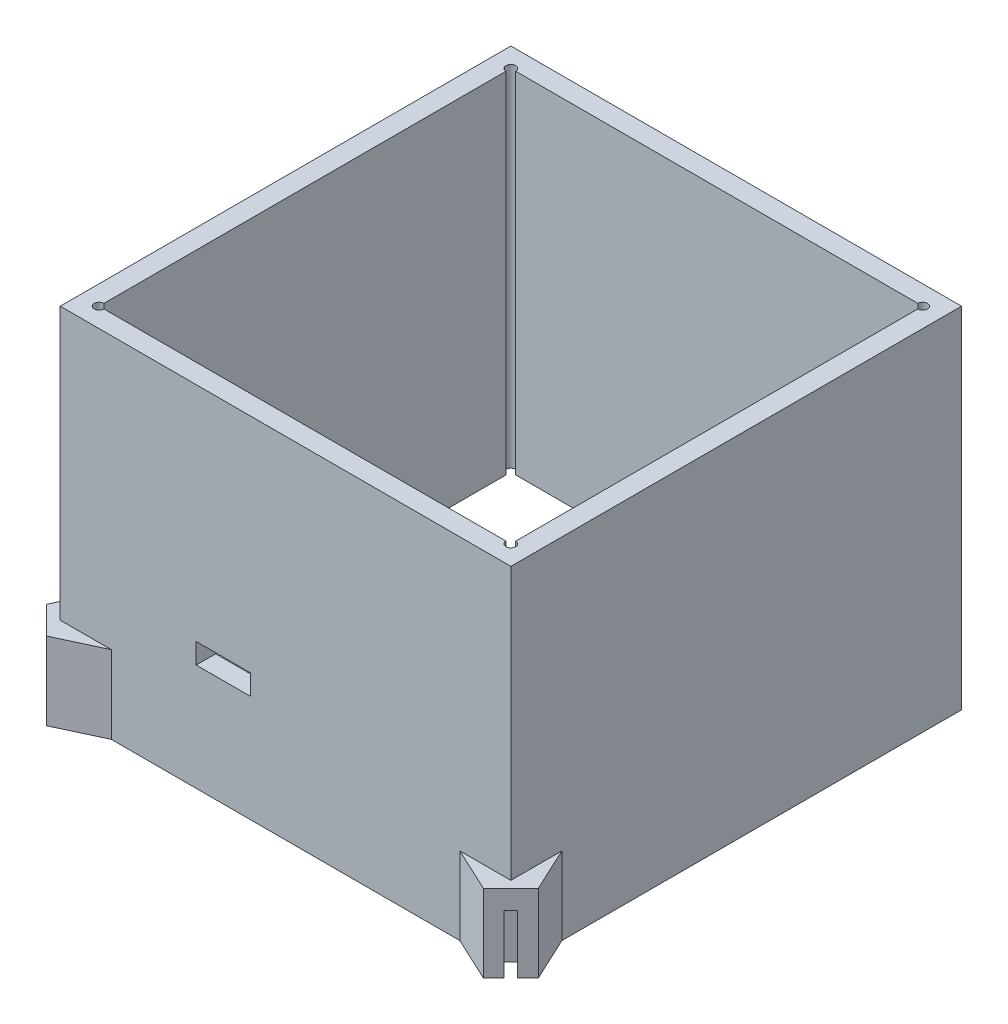
from build123d import *

# Parameters (mm, degrees)
SKETCH2_W           = 232
SKETCH2_H           = 232
SKETCH2_W_2         = 212
SKETCH2_H_2         = 212
BOSS_EXTRUDE1_DEPTH = 180
CUT_EXTRUDE1_REACH  = 317.721
SKETCH3_W           = 28
SKETCH3_H           = 10.5
CUT_EXTRUDE2_REACH  = 317.721
SKETCH4_W           = 28
SKETCH4_H           = 10.5
CUT_EXTRUDE3_REACH  = 245.541
SKETCH5_R           = 2.5
BOSS_EXTRUDE2_DEPTH = 40
BOSS_EXTRUDE3_DEPTH = 40
CUT_EXTRUDE4_DEPTH  = 30


with BuildPart() as part:
    # Sketch2 → Boss-Extrude1 (new body)
    with BuildSketch(Plane(origin=(0, 0, 0), x_dir=(1, 0, 0), z_dir=(0, 1, 0))):
        Rectangle(SKETCH2_W, SKETCH2_H)
        Rectangle(SKETCH2_W_2, SKETCH2_H_2, mode=Mode.SUBTRACT)
    extrude(amount=BOSS_EXTRUDE1_DEPTH)

    # Sketch3 → Cut-Extrude1 (cut, up to next)
    with BuildSketch(Plane.XY.offset(116), mode=Mode.PRIVATE) as cut_extrude1_sk1:
        with Locations((-32, 60.25)):
            Rectangle(SKETCH3_W, SKETCH3_H)
    cut_extrude1_tool1 = extrude(cut_extrude1_sk1.sketch, amount=-CUT_EXTRUDE1_REACH, mode=Mode.PRIVATE) & part.part
    add(cut_extrude1_tool1.solids().sort_by_distance((-32, 60.25, 116))[0], mode=Mode.SUBTRACT)

    # Sketch4 → Cut-Extrude2 (cut, up to next)
    with BuildSketch(Plane(origin=(0, 0, -116), x_dir=(-1, 0, 0), z_dir=(0, 0, -1)), mode=Mode.PRIVATE) as cut_extrude2_sk1:
        with Locations((-32, 60.25)):
            Rectangle(SKETCH4_W, SKETCH4_H)
    cut_extrude2_tool1 = extrude(cut_extrude2_sk1.sketch, amount=-CUT_EXTRUDE2_REACH, mode=Mode.PRIVATE) & part.part
    add(cut_extrude2_tool1.solids().sort_by_distance((32, 60.25, -116))[0], mode=Mode.SUBTRACT)

    # Sketch5 → Cut-Extrude3 (cut, up to next)
    with BuildSketch(Plane(origin=(0, 180, 0), x_dir=(1, 0, 0), z_dir=(0, 1, 0)), mode=Mode.PRIVATE) as cut_extrude3_sk1:
        with Locations((-106, 106)):
            Circle(SKETCH5_R)
    cut_extrude3_tool1 = extrude(cut_extrude3_sk1.sketch, amount=-CUT_EXTRUDE3_REACH, mode=Mode.PRIVATE) & part.part
    # Sketch5 → Cut-Extrude3 (cut, up to next)
    with BuildSketch(Plane(origin=(0, 180, 0), x_dir=(1, 0, 0), z_dir=(0, 1, 0)), mode=Mode.PRIVATE) as cut_extrude3_sk2:
        with Locations((106, 106)):
            Circle(SKETCH5_R)
    cut_extrude3_tool2 = extrude(cut_extrude3_sk2.sketch, amount=-CUT_EXTRUDE3_REACH, mode=Mode.PRIVATE) & part.part
    # Sketch5 → Cut-Extrude3 (cut, up to next)
    with BuildSketch(Plane(origin=(0, 180, 0), x_dir=(1, 0, 0), z_dir=(0, 1, 0)), mode=Mode.PRIVATE) as cut_extrude3_sk3:
        with Locations((106, -106)):
            Circle(SKETCH5_R)
    cut_extrude3_tool3 = extrude(cut_extrude3_sk3.sketch, amount=-CUT_EXTRUDE3_REACH, mode=Mode.PRIVATE) & part.part
    # Sketch5 → Cut-Extrude3 (cut, up to next)
    with BuildSketch(Plane(origin=(0, 180, 0), x_dir=(1, 0, 0), z_dir=(0, 1, 0)), mode=Mode.PRIVATE) as cut_extrude3_sk4:
        with Locations((-106, -106)):
            Circle(SKETCH5_R)
    cut_extrude3_tool4 = extrude(cut_extrude3_sk4.sketch, amount=-CUT_EXTRUDE3_REACH, mode=Mode.PRIVATE) & part.part
    add(cut_extrude3_tool1.solids().sort_by_distance((-106, 180, -106))[0], mode=Mode.SUBTRACT)
    add(cut_extrude3_tool2.solids().sort_by_distance((106, 180, -106))[0], mode=Mode.SUBTRACT)
    add(cut_extrude3_tool3.solids().sort_by_distance((106, 180, 106))[0], mode=Mode.SUBTRACT)
    add(cut_extrude3_tool4.solids().sort_by_distance((-106, 180, 106))[0], mode=Mode.SUBTRACT)

    # Sketch6 → Boss-Extrude2 (add)
    with BuildSketch(Plane(origin=(0, 0, 0), x_dir=(1, 0, 0), z_dir=(0, 1, 0))):
        Polygon((-116, -89.718535307), (-126.606601718, -112.464466094), (-112.464466094, -126.606601718), (-89.718535307, -116), (-116, -116), align=None)
        Polygon((116, -89.718535307), (116, -116), (89.718535307, -116), (112.464466094, -126.606601718), (126.606601718, -112.464466094), align=None)
    extrude(amount=BOSS_EXTRUDE2_DEPTH)

    # Sketch7 → Boss-Extrude3 (add)
    with BuildSketch(Plane(origin=(0, 0, 0), x_dir=(1, 0, 0), z_dir=(0, 1, 0))):
        Polygon((-10, 121), (10, 121), (20.722534603, 116), (-20.722534603, 116), align=None)
    extrude(amount=BOSS_EXTRUDE3_DEPTH)

    # Sketch8 → Cut-Extrude4 (cut)
    with BuildSketch(Plane.XZ):
        Polygon((-114.232233047, 117.767766953), (-117.767766953, 121.303300859), (-121.303300859, 117.767766953), (-117.767766953, 114.232233047), (-121.303300859, 110.696699141), (-117.767766953, 107.161165235), (-107.161165235, 117.767766953), (-110.696699141, 121.303300859), align=None)
        Polygon((-2.5, -121), (2.5, -121), (2.5, -116), (7.5, -116), (7.5, -111), (-7.5, -111), (-7.5, -116), (-2.5, -116), align=None)
        Polygon((117.767766953, 121.303300859), (114.232233047, 117.767766953), (110.696699141, 121.303300859), (107.161165235, 117.767766953), (117.767766953, 107.161165235), (121.303300859, 110.696699141), (117.767766953, 114.232233047), (121.303300859, 117.767766953), align=None)
    extrude(amount=-CUT_EXTRUDE4_DEPTH, mode=Mode.SUBTRACT)


solid = part.part
